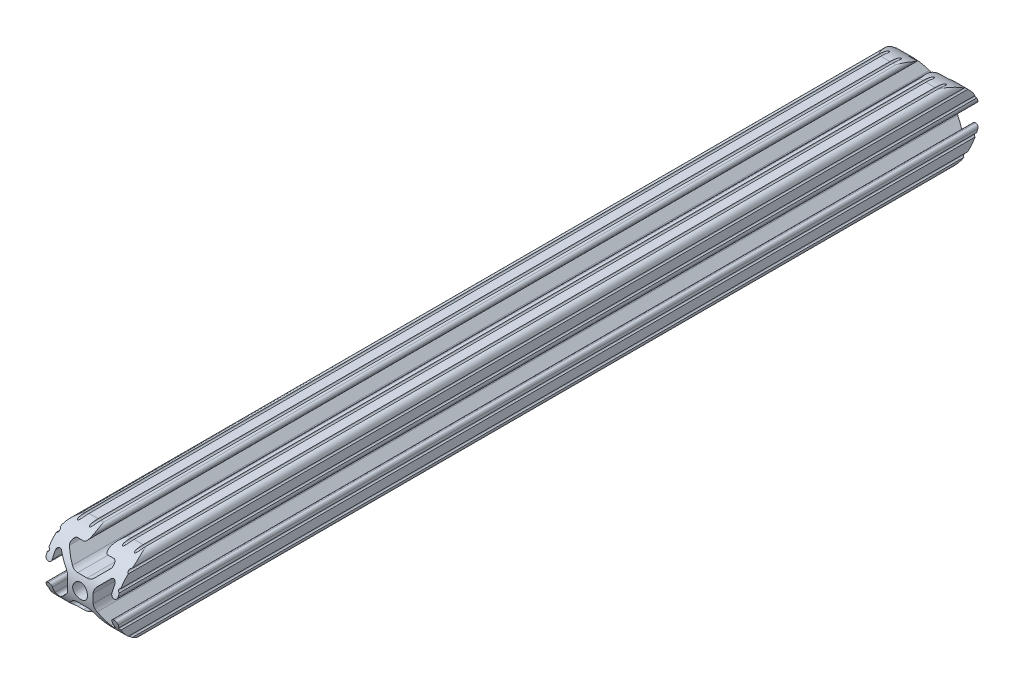
from build123d import *
from build123d.topology import SkipClean

# Parameters (mm, degrees)
SKETCH1_R               = 2.6035
BOSS_EXTRUDE1_DEPTH     = 152.4
CUT_EXTRUDE1_DEPTH      = 156.02325632
CUT_EXTRUDE1_DEPTH_BACK = 156.02325632
SKETCH3_R               = 3.175


with BuildPart() as part:
    # Sketch1 → Boss-Extrude1 (new, symmetric)
    with BuildSketch(Plane.XY):
        with BuildLine():
            Line((-7.179650497, -8.645192506), (-3.952270251, -5.423690499))
            ThreePointArc((-3.952270251, -5.423690499), (-2.922936451, -4.736929036), (-1.709253557, -4.4958))
            Line((-1.709253557, -4.4958), (1.709253557, -4.4958))
            ThreePointArc((1.709253557, -4.4958), (2.922936451, -4.736929036), (3.952270251, -5.423690499))
            Line((3.952270251, -5.423690499), (7.179650497, -8.645192506))
            ThreePointArc((7.179650497, -8.645192506), (7.41473083, -9.822813117), (6.416408329, -10.4902))
            Line((6.416408329, -10.4902), (4.287512407, -10.4902))
            ThreePointArc((4.287512407, -10.4902), (3.54574862, -10.79744862), (3.2385, -11.539212407))
            Line((3.2385, -11.539212407), (3.2385, -11.650987593))
            ThreePointArc((3.2385, -11.650987593), (3.54574862, -12.39275138), (4.287512407, -12.7))
            Line((4.287512407, -12.7), (5.317126718, -12.7))
            ThreePointArc((5.317126718, -12.7), (5.825126718, -12.192), (6.333126718, -12.7))
            Line((6.333126718, -12.7), (9.550443118, -12.7))
            ThreePointArc((9.550443118, -12.7), (10.058366869, -12.192000006), (10.566443095, -12.699847501))
            ThreePointArc((10.566443095, -12.699847501), (12.082537762, -12.08250727), (12.699846982, -10.566399977))
            ThreePointArc((12.699846982, -10.566399977), (12.192000006, -10.058323491), (12.7, -9.5504))
            Line((12.7, -9.5504), (12.7, -6.3330836))
            ThreePointArc((12.7, -6.3330836), (12.192, -5.8250836), (12.7, -5.3170836))
            Line((12.7, -5.3170836), (12.7, -4.287469289))
            ThreePointArc((12.7, -4.287469289), (12.39275138, -3.545705502), (11.650987593, -3.238456882))
            Line((11.650987593, -3.238456882), (11.539212407, -3.238456882))
            ThreePointArc((11.539212407, -3.238456882), (10.79744862, -3.545705502), (10.4902, -4.287469289))
            Line((10.4902, -4.287469289), (10.4902, -6.402089023))
            ThreePointArc((10.4902, -6.402089023), (9.856505071, -7.351067942), (8.737131347, -7.129408934))
            Line((8.737131347, -7.129408934), (5.441005833, -3.840816462))
            ThreePointArc((5.441005833, -3.840816462), (4.750877967, -2.809883091), (4.5085, -1.593185507))
            Line((4.5085, -1.593185507), (4.5085, 1.593185507))
            ThreePointArc((4.5085, 1.593185507), (4.750877967, 2.809883091), (5.441005833, 3.840816462))
            Line((5.441005833, 3.840816462), (8.737131347, 7.129408934))
            ThreePointArc((8.737131347, 7.129408934), (9.856505071, 7.351067942), (10.4902, 6.402089023))
            Line((10.4902, 6.402089023), (10.4902, 4.287469289))
            ThreePointArc((10.4902, 4.287469289), (10.79744862, 3.545705502), (11.539212407, 3.238456882))
            Line((11.539212407, 3.238456882), (11.650987593, 3.238456882))
            ThreePointArc((11.650987593, 3.238456882), (12.39275138, 3.545705502), (12.7, 4.287469289))
            Line((12.7, 4.287469289), (12.7, 5.3170836))
            ThreePointArc((12.7, 5.3170836), (12.192, 5.8250836), (12.7, 6.3330836))
            Line((12.7, 6.3330836), (12.7, 9.5504))
            ThreePointArc((12.7, 9.5504), (12.192000006, 10.058323491), (12.699846982, 10.566399977))
            ThreePointArc((12.699846982, 10.566399977), (12.082537762, 12.08250727), (10.566443095, 12.699847501))
            ThreePointArc((10.566443095, 12.699847501), (10.058366869, 12.192000006), (9.550443118, 12.7))
            Line((9.550443118, 12.7), (6.333126718, 12.7))
            ThreePointArc((6.333126718, 12.7), (5.825126718, 12.192), (5.317126718, 12.7))
            Line((5.317126718, 12.7), (4.287512407, 12.7))
            ThreePointArc((4.287512407, 12.7), (3.54574862, 12.39275138), (3.2385, 11.650987593))
            Line((3.2385, 11.650987593), (3.2385, 11.539212407))
            ThreePointArc((3.2385, 11.539212407), (3.54574862, 10.79744862), (4.287512407, 10.4902))
            Line((4.287512407, 10.4902), (6.476788598, 10.4902))
            ThreePointArc((6.476788598, 10.4902), (7.432222385, 9.85140422), (7.207036008, 8.724370562))
            Line((7.207036008, 8.724370562), (3.898272566, 5.423169045))
            ThreePointArc((3.898272566, 5.423169045), (2.869120213, 4.736787962), (1.655778399, 4.4958))
            Line((1.655778399, 4.4958), (-1.655778399, 4.4958))
            ThreePointArc((-1.655778399, 4.4958), (-2.869120213, 4.736787962), (-3.898272566, 5.423169045))
            Line((-3.898272566, 5.423169045), (-7.207036008, 8.724370562))
            ThreePointArc((-7.207036008, 8.724370562), (-7.432222385, 9.85140422), (-6.476788598, 10.4902))
            Line((-6.476788598, 10.4902), (-4.287512407, 10.4902))
            ThreePointArc((-4.287512407, 10.4902), (-3.54574862, 10.79744862), (-3.2385, 11.539212407))
            Line((-3.2385, 11.539212407), (-3.2385, 11.650987593))
            ThreePointArc((-3.2385, 11.650987593), (-3.54574862, 12.39275138), (-4.287512407, 12.7))
            Line((-4.287512407, 12.7), (-5.317126718, 12.7))
            ThreePointArc((-5.317126718, 12.7), (-5.825126718, 12.192), (-6.333126718, 12.7))
            Line((-6.333126718, 12.7), (-9.550443118, 12.7))
            ThreePointArc((-9.550443118, 12.7), (-10.058366869, 12.192000006), (-10.566443095, 12.699847501))
            ThreePointArc((-10.566443095, 12.699847501), (-12.082537762, 12.08250727), (-12.699846982, 10.566399977))
            ThreePointArc((-12.699846982, 10.566399977), (-12.192000006, 10.058323491), (-12.7, 9.5504))
            Line((-12.7, 9.5504), (-12.7, 6.3330836))
            ThreePointArc((-12.7, 6.3330836), (-12.192, 5.8250836), (-12.7, 5.3170836))
            Line((-12.7, 5.3170836), (-12.7, 4.287469289))
            ThreePointArc((-12.7, 4.287469289), (-12.39275138, 3.545705502), (-11.650987593, 3.238456882))
            Line((-11.650987593, 3.238456882), (-11.539212407, 3.238456882))
            ThreePointArc((-11.539212407, 3.238456882), (-10.79744862, 3.545705502), (-10.4902, 4.287469289))
            Line((-10.4902, 4.287469289), (-10.4902, 6.402089023))
            ThreePointArc((-10.4902, 6.402089023), (-9.856505071, 7.351067942), (-8.737131347, 7.129408934))
            Line((-8.737131347, 7.129408934), (-5.441005833, 3.840816462))
            ThreePointArc((-5.441005833, 3.840816462), (-4.750877967, 2.809883091), (-4.5085, 1.593185507))
            Line((-4.5085, 1.593185507), (-4.5085, -1.593185507))
            ThreePointArc((-4.5085, -1.593185507), (-4.750877967, -2.809883091), (-5.441005833, -3.840816462))
            Line((-5.441005833, -3.840816462), (-8.737131347, -7.129408934))
            ThreePointArc((-8.737131347, -7.129408934), (-9.856505071, -7.351067942), (-10.4902, -6.402089023))
            Line((-10.4902, -6.402089023), (-10.4902, -4.287469289))
            ThreePointArc((-10.4902, -4.287469289), (-10.79744862, -3.545705502), (-11.539212407, -3.238456882))
            Line((-11.539212407, -3.238456882), (-11.650987593, -3.238456882))
            ThreePointArc((-11.650987593, -3.238456882), (-12.39275138, -3.545705502), (-12.7, -4.287469289))
            Line((-12.7, -4.287469289), (-12.7, -5.3170836))
            ThreePointArc((-12.7, -5.3170836), (-12.192, -5.8250836), (-12.7, -6.3330836))
            Line((-12.7, -6.3330836), (-12.7, -9.5504))
            ThreePointArc((-12.7, -9.5504), (-12.192000006, -10.058323491), (-12.699846982, -10.566399977))
            ThreePointArc((-12.699846982, -10.566399977), (-12.082537762, -12.08250727), (-10.566443095, -12.699847501))
            ThreePointArc((-10.566443095, -12.699847501), (-10.058366869, -12.192000006), (-9.550443118, -12.7))
            Line((-9.550443118, -12.7), (-6.333126718, -12.7))
            ThreePointArc((-6.333126718, -12.7), (-5.825126718, -12.192), (-5.317126718, -12.7))
            Line((-5.317126718, -12.7), (-4.287512407, -12.7))
            ThreePointArc((-4.287512407, -12.7), (-3.54574862, -12.39275138), (-3.2385, -11.650987593))
            Line((-3.2385, -11.650987593), (-3.2385, -11.539212407))
            ThreePointArc((-3.2385, -11.539212407), (-3.54574862, -10.79744862), (-4.287512407, -10.4902))
            Line((-4.287512407, -10.4902), (-6.416408329, -10.4902))
            ThreePointArc((-6.416408329, -10.4902), (-7.41473083, -9.822813117), (-7.179650497, -8.645192506))
        make_face()
        Circle(SKETCH1_R, mode=Mode.SUBTRACT)
    extrude(amount=BOSS_EXTRUDE1_DEPTH, both=True)

    # Sketch3 → Cut-Extrude1 (cut, two sides: drawn at the far end of the back side and taken through both)
    with SkipClean():  # the faces are left unmerged after this step: merging them gives an invalid solid
        with BuildSketch(Plane(origin=(12.7, 0, 0), x_dir=(0, 0, -1), z_dir=(1, 0, 0)).offset(-CUT_EXTRUDE1_DEPTH_BACK)):
            with Locations((-139.7, 0)):
                Circle(SKETCH3_R)
            with Locations((-114.3, 0)):
                Circle(SKETCH3_R)
            with BuildLine():
                Line((-152.4, -12.7), (-139.7, -12.7))
                ThreePointArc((-139.7, -12.7), (-148.680256121, -8.980256121), (-152.4, 0))
                Line((-152.4, 0), (-152.4, -12.7))
            make_face()
            with BuildLine():
                ThreePointArc((-152.4, 0), (-148.680256121, 8.980256121), (-139.7, 12.7))
                Line((-139.7, 12.7), (-152.4, 12.7))
                Line((-152.4, 12.7), (-152.4, 0))
            make_face()
            with BuildLine():
                ThreePointArc((152.4, 0), (148.680256128, -8.980256114), (139.700000019, -12.7))
                Line((139.700000019, -12.7), (152.4, -12.7))
                Line((152.4, -12.7), (152.4, 0))
            make_face()
            with BuildLine():
                Line((152.4, 0), (152.4, 12.7))
                Line((152.4, 12.7), (139.700000011, 12.7))
                ThreePointArc((139.700000011, 12.7), (148.680256125, 8.980256117), (152.4, 0))
            make_face()
        extrude(amount=CUT_EXTRUDE1_DEPTH + CUT_EXTRUDE1_DEPTH_BACK, mode=Mode.SUBTRACT)


solid = part.part
